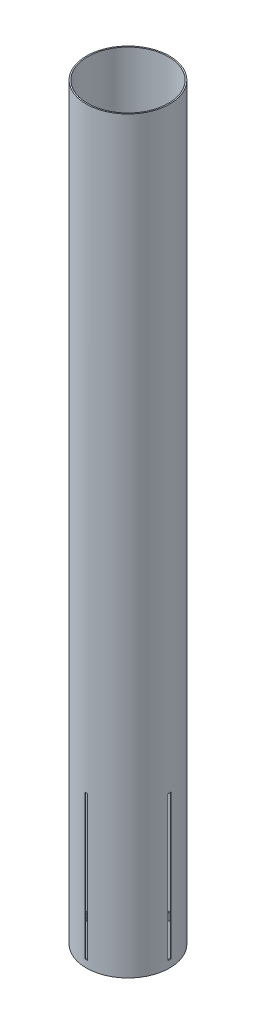
from build123d import *

# Parameters (mm, degrees)
BOSS_EXTRUDE1_DEPTH      = 725
BOSS_EXTRUDE1_DEPTH_BACK = 725
SKETCH1_R                = 80.75
SKETCH1_R_2              = 78.35
SKETCH2_W                = 5.5
SKETCH2_H                = 280
CUT_EXTRUDE1_DEPTH       = 734.938774694
CIRPATTERN1_START        = -711
CIRPATTERN1_DEPTH        = 280


# Read off the part's stored shape, not the designer's step: CirPattern1
with BuildPart() as part:
    # Sketch1 → Boss-Extrude1 (new, two sides: drawn at the far end of the back side and taken through both)
    with BuildSketch(Plane(origin=(0, 0, 0), x_dir=(1, 0, 0), z_dir=(0, 1, 0)).offset(-BOSS_EXTRUDE1_DEPTH_BACK)):
        with Locations(Location((0, 0, 0), (0, 0, 270))):
            Circle(SKETCH1_R)
        with Locations(Location((0, 0, 0), (0, 0, 270))):
            Circle(SKETCH1_R_2, mode=Mode.SUBTRACT)
    extrude(amount=BOSS_EXTRUDE1_DEPTH + BOSS_EXTRUDE1_DEPTH_BACK)

    # Sketch2 → Cut-Extrude1 (cut, symmetric)
    with BuildSketch(Plane.XY):
        with Locations((0, -571)):
            Rectangle(SKETCH2_W, SKETCH2_H)
    extrude(amount=CUT_EXTRUDE1_DEPTH, both=True, mode=Mode.SUBTRACT)

    # CirPattern1 outline → CirPattern1 (cut)
    with BuildSketch(Plane(origin=(0, 0, 0), x_dir=(1, 0, 0), z_dir=(0, 1, 0)).offset(CIRPATTERN1_START)):
        with BuildLine():
            ThreePointArc((78.301724119, 2.75), (78.35, 0), (78.301724119, -2.75))
            Line((78.301724119, -2.75), (80.703159789, -2.75))
            ThreePointArc((80.703159789, -2.75), (80.75, 0), (80.703159789, 2.75))
            Line((80.703159789, 2.75), (78.301724119, 2.75))
        make_face()
        with BuildLine():
            Line((-80.703159789, -2.75), (-78.301724119, -2.75))
            ThreePointArc((-78.301724119, -2.75), (-78.35, 0), (-78.301724119, 2.75))
            Line((-78.301724119, 2.75), (-80.703159789, 2.75))
            ThreePointArc((-80.703159789, 2.75), (-80.75, 0), (-80.703159789, -2.75))
        make_face()
    extrude(amount=CIRPATTERN1_DEPTH, mode=Mode.SUBTRACT)


solid = part.part
